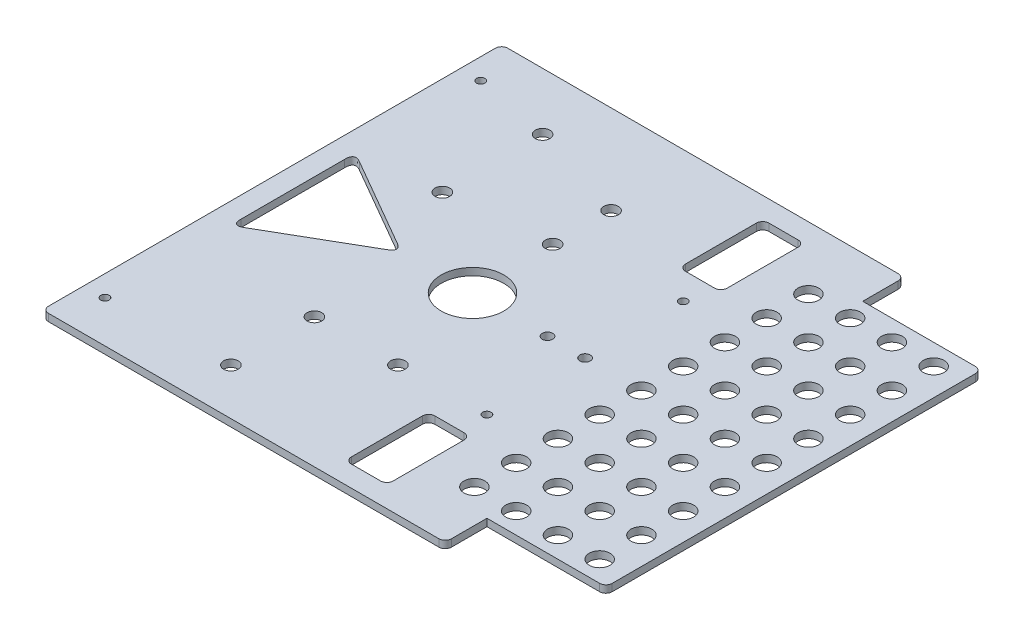
from build123d import *

# Parameters (mm, degrees)
SKETCH1_W                       = 250
SKETCH1_H                       = 220
THE_UPPER_CHASISS_DEPTH         = 1.75
BATTARY_REACH                   = 168.517
SKETCH2_R                       = 2.5
BATTARY_DIRECTION_2_REACH       = 168.517
POWER_SECTION_REACH             = 168.517
SKETCH3_R                       = 3.5
POWER_SECTION_DIRECTION_2_REACH = 168.517
ARDUINO_R                       = 3.5
ARDUINO_SECTION_DEPTH           = 2.5
SKETCH7_R                       = 2
LINK_NAILS_DEPTH                = 5
SKETCH9_W                       = 20
SKETCH9_H                       = 40
RECT_CUT_DEPTH                  = 5
SKETCH10_R                      = 15
CIRC_CUT_DEPTH                  = 5
FILLET5_R                       = 3
SKETCH11_R                      = 5
CUT_EXTRUDE1_DEPTH              = 5
LPATTERN1_COUNT                 = 9
LPATTERN1_PITCH                 = 20
LPATTERN1_COUNT_DIR2            = 4
LPATTERN1_PITCH_DIR2            = 20
CUT_EXTRUDE2_DEPTH              = 5
CUT_EXTRUDE4_DEPTH              = 167.517454182
CUT_EXTRUDE4_DEPTH_BACK         = 167.517454182
FILLET7_R                       = 3


with BuildPart() as part:
    # Sketch1 → the upper chasiss (new, symmetric)
    with BuildSketch(Plane(origin=(0, 0, 0), x_dir=(1, 0, 0), z_dir=(0, 1, 0))):
        Rectangle(SKETCH1_W, SKETCH1_H)
    extrude(amount=THE_UPPER_CHASISS_DEPTH, both=True)

    # Battary: up to this face of the body (flat: up to its plane)
    battary_end = Plane(part.part.faces().sort_by_distance((0, 1.75, 0))[0])
    # Sketch2 → Battary (cut, up to the picked face)
    with BuildSketch(Plane(origin=(0, 0, 0), x_dir=(1, 0, 0), z_dir=(0, 1, 0)), mode=Mode.PRIVATE) as battary_sk1:
        with Locations(Location((25, 0, 0), (0, 0, 90))):
            Circle(SKETCH2_R)
    battary_tool1 = split(extrude(battary_sk1.sketch, amount=BATTARY_REACH, mode=Mode.PRIVATE), bisect_by=battary_end, keep=Keep.BOTH, mode=Mode.PRIVATE)
    # Sketch2 → Battary (cut, up to the picked face)
    with BuildSketch(Plane(origin=(0, 0, 0), x_dir=(1, 0, 0), z_dir=(0, 1, 0)), mode=Mode.PRIVATE) as battary_sk2:
        with Locations(Location((7, 0, 0), (0, 0, 90))):
            Circle(SKETCH2_R)
    battary_tool2 = split(extrude(battary_sk2.sketch, amount=BATTARY_REACH, mode=Mode.PRIVATE), bisect_by=battary_end, keep=Keep.BOTH, mode=Mode.PRIVATE)
    add(battary_tool1.solids().sort_by(Axis((25, 0, 0), (0, 1, 0)))[0], mode=Mode.SUBTRACT)
    add(battary_tool2.solids().sort_by(Axis((7, 0, 0), (0, 1, 0)))[0], mode=Mode.SUBTRACT)

    # Battary direction 2: up to this face of the body (flat: up to its plane)
    battary_direction_2_end = Plane(part.part.faces().sort_by_distance((0, -1.75, 0))[0])
    # Sketch2 → Battary direction 2 (cut, up to the picked face)
    with BuildSketch(Plane(origin=(0, 0, 0), x_dir=(1, 0, 0), z_dir=(0, 1, 0)), mode=Mode.PRIVATE) as battary_direction_2_sk1:
        with Locations(Location((25, 0, 0), (0, 0, 90))):
            Circle(SKETCH2_R)
    battary_direction_2_tool1 = split(extrude(battary_direction_2_sk1.sketch, amount=-BATTARY_DIRECTION_2_REACH, mode=Mode.PRIVATE), bisect_by=battary_direction_2_end, keep=Keep.BOTH, mode=Mode.PRIVATE)
    # Sketch2 → Battary direction 2 (cut, up to the picked face)
    with BuildSketch(Plane(origin=(0, 0, 0), x_dir=(1, 0, 0), z_dir=(0, 1, 0)), mode=Mode.PRIVATE) as battary_direction_2_sk2:
        with Locations(Location((7, 0, 0), (0, 0, 90))):
            Circle(SKETCH2_R)
    battary_direction_2_tool2 = split(extrude(battary_direction_2_sk2.sketch, amount=-BATTARY_DIRECTION_2_REACH, mode=Mode.PRIVATE), bisect_by=battary_direction_2_end, keep=Keep.BOTH, mode=Mode.PRIVATE)
    add(battary_direction_2_tool1.solids().sort_by(Axis((25, 0, 0), (0, -1, 0)))[0], mode=Mode.SUBTRACT)
    add(battary_direction_2_tool2.solids().sort_by(Axis((7, 0, 0), (0, -1, 0)))[0], mode=Mode.SUBTRACT)

    # power section: up to this face of the body (flat: up to its plane)
    power_section_end = Plane(part.part.faces().sort_by_distance((-0.011432136, -1.75, 0))[0])
    # Sketch3 → power section (cut, up to the picked face)
    with BuildSketch(Plane(origin=(0, 0, 0), x_dir=(1, 0, 0), z_dir=(0, 1, 0)), mode=Mode.PRIVATE) as power_section_sk1:
        with Locations(Location((-56.898371951, -47.760148577, 0), (0, 0, 90))):
            Circle(SKETCH3_R)
    power_section_tool1 = split(extrude(power_section_sk1.sketch, amount=-POWER_SECTION_REACH, mode=Mode.PRIVATE), bisect_by=power_section_end, keep=Keep.BOTH, mode=Mode.PRIVATE)
    # Sketch3 → power section (cut, up to the picked face)
    with BuildSketch(Plane(origin=(0, 0, 0), x_dir=(1, 0, 0), z_dir=(0, 1, 0)), mode=Mode.PRIVATE) as power_section_sk2:
        with Locations(Location((-16.898371951, -47.760148577, 0), (0, 0, 90))):
            Circle(SKETCH3_R)
    power_section_tool2 = split(extrude(power_section_sk2.sketch, amount=-POWER_SECTION_REACH, mode=Mode.PRIVATE), bisect_by=power_section_end, keep=Keep.BOTH, mode=Mode.PRIVATE)
    # Sketch3 → power section (cut, up to the picked face)
    with BuildSketch(Plane(origin=(0, 0, 0), x_dir=(1, 0, 0), z_dir=(0, 1, 0)), mode=Mode.PRIVATE) as power_section_sk3:
        with Locations(Location((-56.898371951, -87.760148577, 0), (0, 0, 90))):
            Circle(SKETCH3_R)
    power_section_tool3 = split(extrude(power_section_sk3.sketch, amount=-POWER_SECTION_REACH, mode=Mode.PRIVATE), bisect_by=power_section_end, keep=Keep.BOTH, mode=Mode.PRIVATE)
    add(power_section_tool1.solids().sort_by(Axis((-56.898372, 0, 47.760149), (0, -1, 0)))[0], mode=Mode.SUBTRACT)
    add(power_section_tool2.solids().sort_by(Axis((-16.898372, 0, 47.760149), (0, -1, 0)))[0], mode=Mode.SUBTRACT)
    add(power_section_tool3.solids().sort_by(Axis((-56.898372, 0, 87.760149), (0, -1, 0)))[0], mode=Mode.SUBTRACT)

    # power section direction 2: up to this face of the body (flat: up to its plane)
    power_section_direction_2_end = Plane(part.part.faces().sort_by_distance((-0.011432136, 1.75, 0))[0])
    # Sketch3 → power section direction 2 (cut, up to the picked face)
    with BuildSketch(Plane(origin=(0, 0, 0), x_dir=(1, 0, 0), z_dir=(0, 1, 0)), mode=Mode.PRIVATE) as power_section_direction_2_sk1:
        with Locations(Location((-56.898371951, -47.760148577, 0), (0, 0, 90))):
            Circle(SKETCH3_R)
    power_section_direction_2_tool1 = split(extrude(power_section_direction_2_sk1.sketch, amount=POWER_SECTION_DIRECTION_2_REACH, mode=Mode.PRIVATE), bisect_by=power_section_direction_2_end, keep=Keep.BOTH, mode=Mode.PRIVATE)
    # Sketch3 → power section direction 2 (cut, up to the picked face)
    with BuildSketch(Plane(origin=(0, 0, 0), x_dir=(1, 0, 0), z_dir=(0, 1, 0)), mode=Mode.PRIVATE) as power_section_direction_2_sk2:
        with Locations(Location((-16.898371951, -47.760148577, 0), (0, 0, 90))):
            Circle(SKETCH3_R)
    power_section_direction_2_tool2 = split(extrude(power_section_direction_2_sk2.sketch, amount=POWER_SECTION_DIRECTION_2_REACH, mode=Mode.PRIVATE), bisect_by=power_section_direction_2_end, keep=Keep.BOTH, mode=Mode.PRIVATE)
    # Sketch3 → power section direction 2 (cut, up to the picked face)
    with BuildSketch(Plane(origin=(0, 0, 0), x_dir=(1, 0, 0), z_dir=(0, 1, 0)), mode=Mode.PRIVATE) as power_section_direction_2_sk3:
        with Locations(Location((-56.898371951, -87.760148577, 0), (0, 0, 90))):
            Circle(SKETCH3_R)
    power_section_direction_2_tool3 = split(extrude(power_section_direction_2_sk3.sketch, amount=POWER_SECTION_DIRECTION_2_REACH, mode=Mode.PRIVATE), bisect_by=power_section_direction_2_end, keep=Keep.BOTH, mode=Mode.PRIVATE)
    add(power_section_direction_2_tool1.solids().sort_by(Axis((-56.898372, 0, 47.760149), (0, 1, 0)))[0], mode=Mode.SUBTRACT)
    add(power_section_direction_2_tool2.solids().sort_by(Axis((-16.898372, 0, 47.760149), (0, 1, 0)))[0], mode=Mode.SUBTRACT)
    add(power_section_direction_2_tool3.solids().sort_by(Axis((-56.898372, 0, 87.760149), (0, 1, 0)))[0], mode=Mode.SUBTRACT)

    # arduino → arduino section (cut, symmetric)
    with BuildSketch(Plane(origin=(0, 0, 0), x_dir=(1, 0, 0), z_dir=(0, 1, 0))):
        with Locations(Location((-77.933527642, 82.588848983, 0), (0, 0, 90))):
            Circle(ARDUINO_R)
        with Locations(Location((-77.933527642, 34.588848983, 0), (0, 0, 90))):
            Circle(ARDUINO_R)
        with Locations(Location((-29.933527642, 67.388848983, 0), (0, 0, 90))):
            Circle(ARDUINO_R)
        with Locations(Location((-29.933527642, 39.388848983, 0), (0, 0, 90))):
            Circle(ARDUINO_R)
    extrude(amount=ARDUINO_SECTION_DEPTH, both=True, mode=Mode.SUBTRACT)

    # Sketch7 → link nails (cut, symmetric)
    with BuildSketch(Plane(origin=(0, 1.75, 0), x_dir=(1, 0, 0), z_dir=(0, 1, 0))):
        with Locations(Location((-115, -90, 0), (0, 0, 90))):
            Circle(SKETCH7_R)
        with Locations(Location((-115, 90, 0), (0, 0, 90))):
            Circle(SKETCH7_R)
        with Locations(Location((25, 47, 0), (0, 0, 90))):
            Circle(SKETCH7_R)
        with Locations(Location((25, -47, 0), (0, 0, 90))):
            Circle(SKETCH7_R)
    extrude(amount=LINK_NAILS_DEPTH, both=True, mode=Mode.SUBTRACT)

    # Sketch9 → rect cut (cut, symmetric)
    with BuildSketch(Plane(origin=(0, 1.75, 0), x_dir=(1, 0, 0), z_dir=(0, 1, 0))):
        with Locations((20.066472358, 80)):
            Rectangle(SKETCH9_W, SKETCH9_H)
        with Locations((20.066472358, -80)):
            Rectangle(SKETCH9_W, SKETCH9_H)
    extrude(amount=RECT_CUT_DEPTH, both=True, mode=Mode.SUBTRACT)

    # Sketch10 → circ cut (cut, symmetric)
    with BuildSketch(Plane(origin=(0, 1.75, 0), x_dir=(1, 0, 0), z_dir=(0, 1, 0))):
        with Locations(Location((-28.923539072, 0, 0), (0, 0, 90))):
            Circle(SKETCH10_R)
    extrude(amount=CIRC_CUT_DEPTH, both=True, mode=Mode.SUBTRACT)

    # Fillet5
    fillet5_edges = [part.edges().sort_by_distance(p)[0] for p in [
        (10.066472358, 0, 100),
        (10.066472358, 0, 60),
        (30.066472358, 0, 60),
        (30.066472358, 0, 100),
        (30.066472358, 0, -100),
        (30.066472358, 0, -60),
        (10.066472358, 0, -60),
        (10.066472358, 0, -100),
    ]]
    fillet(fillet5_edges, radius=FILLET5_R)

    # Sketch11 → Cut-Extrude1 (cut, symmetric)
    with BuildSketch(Plane(origin=(0, 0, 0), x_dir=(1, 0, 0), z_dir=(0, 1, 0))):
        with Locations(Location((112, 80, 0), (0, 0, 90))):
            Circle(SKETCH11_R)
    cut_extrude1 = extrude(amount=CUT_EXTRUDE1_DEPTH, both=True, mode=Mode.SUBTRACT)

    # LPattern1: Cut-Extrude1 9 × 4
    with Locations(*[(-j * LPATTERN1_PITCH_DIR2, 0, i * LPATTERN1_PITCH) for i in range(LPATTERN1_COUNT) for j in range(LPATTERN1_COUNT_DIR2) if (i, j) != (0, 0)]):
        add(cut_extrude1, mode=Mode.SUBTRACT)

    # Sketch13 → Cut-Extrude2 (cut, symmetric)
    with BuildSketch(Plane(origin=(0, 0, 0), x_dir=(1, 0, 0), z_dir=(0, 1, 0))):
        Polygon((-115, 30), (-63.038475773, 0), (-115, -30), align=None)
    extrude(amount=CUT_EXTRUDE2_DEPTH, both=True, mode=Mode.SUBTRACT)

    # Fillet6
    # a fillet whose section is not a circle: 3 mm, written as the material it adds along each edge (its section moved 0.00015 mm through the faces so that the kernel can cut it)
    with BuildSketch(Plane(origin=(-115, -1.75, 30), x_dir=(0.8660398371803181, 0, -0.4999749997916777), z_dir=(0, 1, 0)), Plane(origin=(-63.038475773, 1.75, 0), x_dir=(-0.8660109696668712, 0, 0.500024999791656), z_dir=(0, -1, 0)), Plane(origin=(-115, -1.75, -30), x_dir=(-2.8867513448411456e-05, 0, 0.9999999995833333), z_dir=(0, 1, 0))) as fillet6_piece_1:
        with BuildLine():
            add(Edge.make_bspline([(5.196152425, 0), (4.416690591, -2.2501e-05), (3.637228756, -4.5002e-05), (1.991685226, 0.449929995), (1.385406821, 1.499964994), (1.818393539, 3.150059994), (2.20810497, 3.825104994), (2.5978164, 4.500149994)], knots=[0, 0, 0, 0, 0, 0, 0.5, 0.5, 1, 1, 1, 1, 1, 1], degree=5))
            Line((2.5978164, 4.500149994), (2.54585401, 4.530148494))
            ThreePointArc((2.54585401, 4.530148494), (1.247010763, 2.280035999), (-0.05196239, 0.0299985))
            Line((-0.05196239, 0.0299985), (1.732e-06, -0.06))
            ThreePointArc((1.732e-06, -0.06), (2.598077942, -0.059925), (5.196154157, -0.06))
            Line((5.196154157, -0.06), (5.196152425, 0))
        make_face()
    extrude(amount=3.5)

    # Sketch16 → Cut-Extrude4 (cut, two sides: drawn at the far end of the back side and taken through both)
    with BuildSketch(Plane(origin=(0, 0, 0), x_dir=(1, 0, 0), z_dir=(0, 1, 0)).offset(-CUT_EXTRUDE4_DEPTH_BACK)):
        Polygon((68, 705.317008407), (68, 110), (68, 90), (125, 90), (125, -90), (68, -90), (68, -110), (68, -705.317008407), (1258.634016814, -705.317008407), (1258.634016814, 705.317008407), align=None)
    extrude(amount=CUT_EXTRUDE4_DEPTH + CUT_EXTRUDE4_DEPTH_BACK, mode=Mode.SUBTRACT)

    # Fillet7
    fillet7_edges = [part.edges().sort_by_distance(p)[0] for p in [
        (125, 0, 90),
        (68, 0, 110),
        (125, 0, -90),
        (68, 0, -110),
        (-125, 0, 110),
        (-125, 0, -110),
    ]]
    fillet(fillet7_edges, radius=FILLET7_R)


solid = part.part
